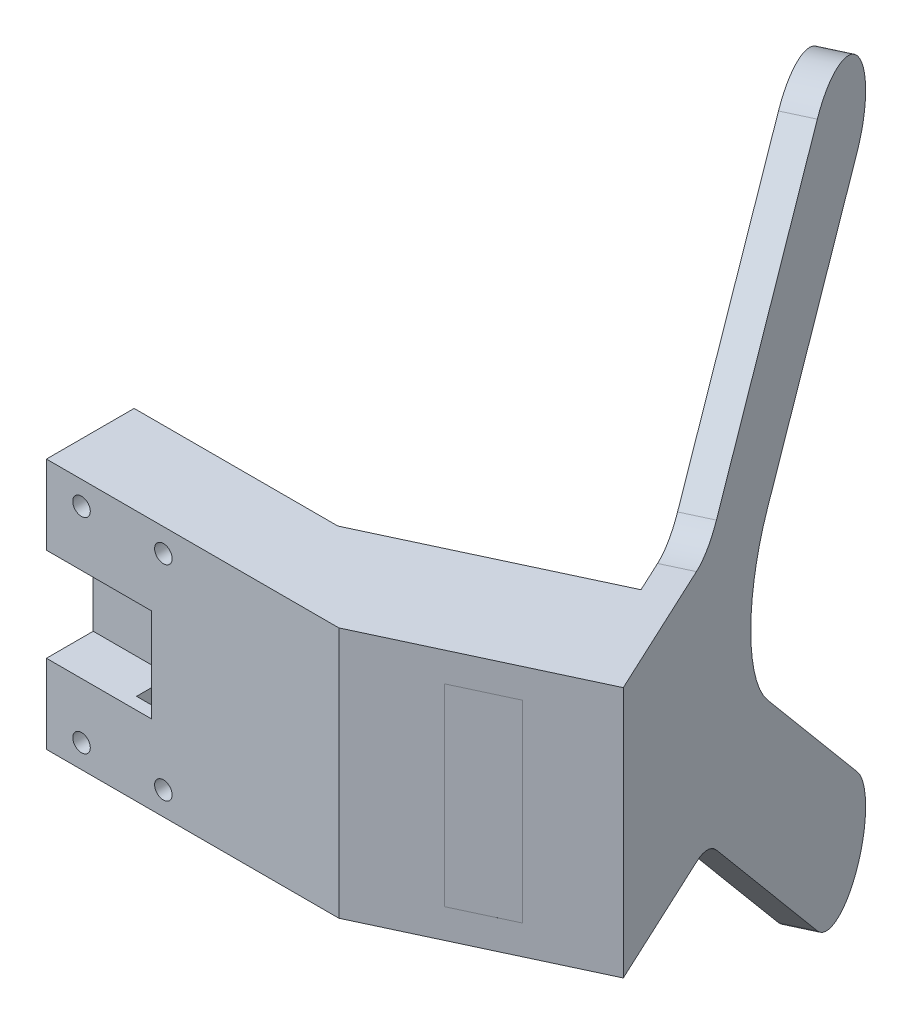
from build123d import *

# Parameters (mm, degrees)
AUFSATZ_LINEAR_AUSTRAGEN1_DEPTH      = 43
AUFSATZ_LINEAR_AUSTRAGEN2_DEPTH      = 5
SCHNITT_LINEAR_AUSTRAGEN1_REACH      = 157.451
SKIZZE3_R                            = 1.5
SKIZZE4_W                            = 8
SKIZZE4_H                            = 16
SCHNITT_LINEAR_AUSTRAGEN2_DEPTH      = 18
SKIZZE5_W                            = 30
SKIZZE5_H                            = 39
SCHNITT_LINEAR_AUSTRAGEN3_DEPTH      = 18
SKIZZE6_W                            = 7
SKIZZE6_H                            = 7.5
SKIZZE6_H_2                          = 14
SKIZZE6_H_3                          = 5.5
AUFSATZ_LINEAR_AUSTRAGEN3_DEPTH      = 4
VERRUNDUNG1_R                        = 2
F_3_4_3_4_DURCHMESSER_BOHRUNG1_D     = 3.4
F_3_4_3_4_DURCHMESSER_BOHRUNG1_DEPTH = 4
SKIZZE10_W                           = 10
SKIZZE10_H                           = 33
SCHNITT_LINEAR_AUSTRAGEN4_DEPTH      = 1
SKIZZE11_W                           = 10
SKIZZE11_H                           = 33
SCHNITT_LINEAR_AUSTRAGEN5_DEPTH      = 0.001
SCHNITT_LINEAR_AUSTRAGEN7_DEPTH      = 39
SKIZZE15_W                           = 10.432594073
SKIZZE15_H                           = 24
SCHNITT_LINEAR_AUSTRAGEN10_DEPTH     = 16
SKIZZE16_W                           = 2.1
SKIZZE16_H                           = 39
SCHNITT_LINEAR_AUSTRAGEN11_DEPTH     = 2
VERRUNDUNG2_R                        = 20
VERRUNDUNG3_R                        = 10
SKIZZE17_W                           = 6
SKIZZE17_H                           = 6
AUFSATZ_LINEAR_AUSTRAGEN4_DEPTH      = 5
FASE1_SIZE                           = 6
F_3_4_3_4_DURCHMESSER_BOHRUNG2_D     = 3.4
F_3_4_3_4_DURCHMESSER_BOHRUNG2_DEPTH = 5
F_3_4_3_4_DURCHMESSER_BOHRUNG2_TIP   = 1.021463052


with BuildPart() as part:
    # Skizze1 → Aufsatz-Linear austragen1 (new body)
    with BuildSketch(Plane(origin=(0, 0, 0), x_dir=(1, 0, 0), z_dir=(0, 1, 0))):
        Polygon((0, 0), (50, 0), (78.641941074, 13.355956467), (70.189575839, 31.482112208), (34.843572145, 15), (0, 15), align=None)
    extrude(amount=AUFSATZ_LINEAR_AUSTRAGEN1_DEPTH)

    # Skizze2 → Aufsatz-Linear austragen2 (add)
    with BuildSketch(Plane(origin=(69.711631316, 0, -32.507067545), x_dir=(-0.4226182617407004, 0, -0.9063077870366495), z_dir=(0.9063077870366495, 0, -0.4226182617407004))):
        Polygon((-21.130913087, 43), (8.869086913, 43), (54.544231126, 88.675144213), (68.686366749, 74.533008589), (15.65335816, 21.5), (68.686366749, -31.533008589), (54.544231126, -45.675144213), (8.869086913, 0), (-21.130913087, 0), align=None)
    extrude(amount=AUFSATZ_LINEAR_AUSTRAGEN2_DEPTH)

    # Skizze3 → Schnitt-Linear austragen1 (cut, up to next)
    with BuildSketch(Plane.XY, mode=Mode.PRIVATE) as schnitt_linear_austragen1_sk1:
        with Locations((6, 39)):
            Circle(SKIZZE3_R)
    schnitt_linear_austragen1_tool1 = extrude(schnitt_linear_austragen1_sk1.sketch, amount=-SCHNITT_LINEAR_AUSTRAGEN1_REACH, mode=Mode.PRIVATE) & part.part
    # Skizze3 → Schnitt-Linear austragen1 (cut, up to next)
    with BuildSketch(Plane.XY, mode=Mode.PRIVATE) as schnitt_linear_austragen1_sk2:
        with Locations((20, 39)):
            Circle(SKIZZE3_R)
    schnitt_linear_austragen1_tool2 = extrude(schnitt_linear_austragen1_sk2.sketch, amount=-SCHNITT_LINEAR_AUSTRAGEN1_REACH, mode=Mode.PRIVATE) & part.part
    # Skizze3 → Schnitt-Linear austragen1 (cut, up to next)
    with BuildSketch(Plane.XY, mode=Mode.PRIVATE) as schnitt_linear_austragen1_sk3:
        with Locations((6, 4)):
            Circle(SKIZZE3_R)
    schnitt_linear_austragen1_tool3 = extrude(schnitt_linear_austragen1_sk3.sketch, amount=-SCHNITT_LINEAR_AUSTRAGEN1_REACH, mode=Mode.PRIVATE) & part.part
    # Skizze3 → Schnitt-Linear austragen1 (cut, up to next)
    with BuildSketch(Plane.XY, mode=Mode.PRIVATE) as schnitt_linear_austragen1_sk4:
        with Locations((20, 4)):
            Circle(SKIZZE3_R)
    schnitt_linear_austragen1_tool4 = extrude(schnitt_linear_austragen1_sk4.sketch, amount=-SCHNITT_LINEAR_AUSTRAGEN1_REACH, mode=Mode.PRIVATE) & part.part
    add(schnitt_linear_austragen1_tool1.solids().sort_by_distance((6, 39, 0))[0], mode=Mode.SUBTRACT)
    add(schnitt_linear_austragen1_tool2.solids().sort_by_distance((20, 39, 0))[0], mode=Mode.SUBTRACT)
    add(schnitt_linear_austragen1_tool3.solids().sort_by_distance((6, 4, 0))[0], mode=Mode.SUBTRACT)
    add(schnitt_linear_austragen1_tool4.solids().sort_by_distance((20, 4, 0))[0], mode=Mode.SUBTRACT)

    # Skizze4 → Schnitt-Linear austragen2 (cut)
    with BuildSketch(Plane.ZY):
        with Locations((-4, 21.5)):
            Rectangle(SKIZZE4_W, SKIZZE4_H)
    extrude(amount=-SCHNITT_LINEAR_AUSTRAGEN2_DEPTH, mode=Mode.SUBTRACT)

    # Skizze5 → Schnitt-Linear austragen3 (cut)
    with BuildSketch(Plane(origin=(0.477944523, 0, 1.024955337), x_dir=(-0.9063077870366492, 0, 0.4226182617407011), z_dir=(-0.4226182617407011, 0, -0.9063077870366492))):
        with Locations((-60.918274689, 21.5)):
            Rectangle(SKIZZE5_W, SKIZZE5_H)
    extrude(amount=-SCHNITT_LINEAR_AUSTRAGEN3_DEPTH, mode=Mode.SUBTRACT)

    # Skizze6 → Aufsatz-Linear austragen3 (add)
    with BuildSketch(Plane(origin=(8.085073234, 0, 17.338495504), x_dir=(-0.9063077870366492, 0, 0.42261826174070133), z_dir=(-0.42261826174070133, 0, -0.9063077870366492))):
        with Locations((-72.418274689, 37.25)):
            Rectangle(SKIZZE6_W, SKIZZE6_H)
        with Locations((-72.418274689, 18.5)):
            Rectangle(SKIZZE6_W, SKIZZE6_H_2)
        with Locations((-72.418274689, 4.75)):
            Rectangle(SKIZZE6_W, SKIZZE6_H_3)
    extrude(amount=AUFSATZ_LINEAR_AUSTRAGEN3_DEPTH)

    # Verrundung1
    verrundung1_edges = [part.edges().sort_by_distance(p)[0] for p in [
        (69.701005731, 33.5, -13.600241521),
        (69.701005731, 11.5, -13.600241521),
        (69.701005731, 25.5, -13.600241521),
        (69.701005731, 7.5, -13.600241521),
    ]]
    fillet(verrundung1_edges, radius=VERRUNDUNG1_R)

    # Ø3.4 (3.4) Durchmesser Bohrung1
    with Locations(Plane(origin=(6.394600187, 0, 13.713264356), x_dir=(-0.906307787036649, 0, 0.4226182617407016), z_dir=(-0.4226182617407016, 0, -0.906307787036649))):
        with Locations((-72.418274689, 37), (-72.418274689, 22), (-71.418274689, 14.1), (-71.418274689, 5)):
            Hole(F_3_4_3_4_DURCHMESSER_BOHRUNG1_D / 2, depth=F_3_4_3_4_DURCHMESSER_BOHRUNG1_DEPTH)

    # Skizze10 → Schnitt-Linear austragen4 (cut)
    with BuildSketch(Plane(origin=(8.085073234, 0, 17.338495504), x_dir=(-0.9063077870366492, 0, 0.42261826174070133), z_dir=(-0.42261826174070133, 0, -0.9063077870366492))):
        with Locations((-63.918274689, 21.5)):
            Rectangle(SKIZZE10_W, SKIZZE10_H)
    extrude(amount=-SCHNITT_LINEAR_AUSTRAGEN4_DEPTH, mode=Mode.SUBTRACT)

    # Skizze11 → Schnitt-Linear austragen5 (cut)
    with BuildSketch(Plane(origin=(8.930309758, 0, 19.151111078), x_dir=(0.9063077870366492, 0, -0.42261826174070133), z_dir=(0.42261826174070133, 0, 0.9063077870366492))):
        with Locations((63.918274689, 21.5)):
            Rectangle(SKIZZE11_W, SKIZZE11_H)
    extrude(amount=-SCHNITT_LINEAR_AUSTRAGEN5_DEPTH, mode=Mode.SUBTRACT)

    # Skizze12 → Schnitt-Linear austragen7 (cut)
    with BuildSketch(Plane(origin=(0, 2, 0), x_dir=(1, 0, 0), z_dir=(0, 1, 0))):
        Polygon((49.701163152, 2.067405927), (42.094034441, 18.380946094), (34.843572145, 15), (34.843572145, 12.5), (29.343572145, 12.5), (29.343572145, 2.067405927), align=None)
    extrude(amount=SCHNITT_LINEAR_AUSTRAGEN7_DEPTH, mode=Mode.SUBTRACT)

    # Skizze15 → Schnitt-Linear austragen10 (cut)
    with BuildSketch(Plane(origin=(29.343572145, 0, 0), x_dir=(0, 0, -1), z_dir=(1, 0, 0))):
        with Locations((7.283702963, 21.5)):
            Rectangle(SKIZZE15_W, SKIZZE15_H)
    extrude(amount=-SCHNITT_LINEAR_AUSTRAGEN10_DEPTH, mode=Mode.SUBTRACT)

    # Skizze16 → Schnitt-Linear austragen11 (cut)
    with BuildSketch(Plane(origin=(68.805323529, 0, -32.084449283), x_dir=(0.42261826174070133, 0, 0.9063077870366492), z_dir=(-0.9063077870366492, 0, 0.42261826174070133))):
        with Locations((2.180913087, 21.5)):
            Rectangle(SKIZZE16_W, SKIZZE16_H)
    extrude(amount=-SCHNITT_LINEAR_AUSTRAGEN11_DEPTH, mode=Mode.SUBTRACT)

    # Verrundung2
    verrundung2_edges = [part.edges().sort_by_distance(p)[0] for p in [
        (65.362005767, 21.5, -47.750373594),
    ]]
    fillet(verrundung2_edges, radius=VERRUNDUNG2_R)

    # Verrundung3
    verrundung3_edges = [part.edges().sort_by_distance(p)[0] for p in [
        (68.229162689, 43, -41.601735733),
        (68.229162689, 0, -41.601735733),
        (42.949287863, 74.533008589, -95.814602248),
        (48.926012637, 88.675144213, -82.997474607),
        (48.926012637, -45.675144213, -82.997474607),
        (42.949287863, -31.533008589, -95.814602248),
    ]]
    fillet(verrundung3_edges, radius=VERRUNDUNG3_R - 0.0001)  # a hair under: the kernel refuses the full size

    # Skizze17 → Aufsatz-Linear austragen4 (add)
    with BuildSketch(Plane(origin=(1.323181047, 0, 2.837570911), x_dir=(-0.9063077870366492, 0, 0.4226182617407011), z_dir=(-0.4226182617407011, 0, -0.9063077870366492))):
        with Locations((-40.918274689, 38)):
            Rectangle(SKIZZE17_W, SKIZZE17_H)
        with Locations((-40.918274689, 5)):
            Rectangle(SKIZZE17_W, SKIZZE17_H)
    extrude(amount=-AUFSATZ_LINEAR_AUSTRAGEN4_DEPTH)

    # Fase1
    fase1_edges = [part.edges().sort_by_distance(p)[0] for p in [
        (40.520823338, 2, -9.923700276),
        (40.520823338, 41, -9.923700276),
    ]]
    chamfer(fase1_edges, length=FASE1_SIZE - 0.0001)  # a hair under: the kernel refuses the full size

    # Ø3.4 (3.4) Durchmesser Bohrung2
    with Locations(Plane(origin=(1.323181047, 0, 2.837570911), x_dir=(-0.9063077870366492, 0, 0.4226182617407014), z_dir=(-0.42261826174070133, 0, -0.906307787036649))):
        with Locations((-40.918274689, 38), (-40.918274689, 5)):
            Hole(F_3_4_3_4_DURCHMESSER_BOHRUNG2_D / 2, depth=F_3_4_3_4_DURCHMESSER_BOHRUNG2_DEPTH)
            with Locations((0, 0, -(F_3_4_3_4_DURCHMESSER_BOHRUNG2_DEPTH + F_3_4_3_4_DURCHMESSER_BOHRUNG2_TIP / 2))):  # 118° drill point
                Cone(0, F_3_4_3_4_DURCHMESSER_BOHRUNG2_D / 2, F_3_4_3_4_DURCHMESSER_BOHRUNG2_TIP, mode=Mode.SUBTRACT)


solid = part.part
